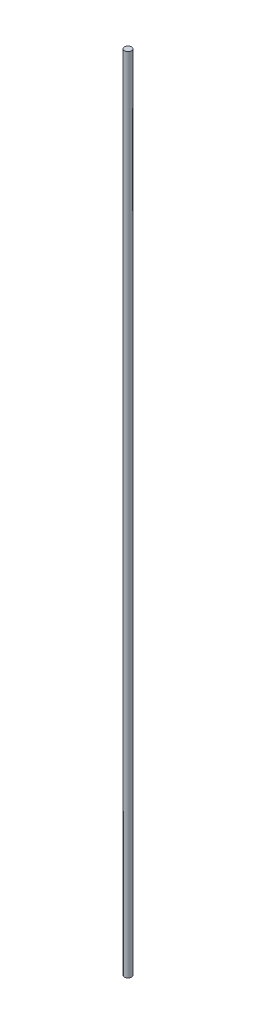
from build123d import *

# Parameters (mm, degrees)
THREADED_ROD_PROFILE_R  = 3.175
THREADED_ROD_BODY_DEPTH = 730.25


with BuildPart() as part:
    # Threaded Rod Profile → Threaded Rod Body (new body)
    with BuildSketch(Plane(origin=(0, 0, 0), x_dir=(1, 0, 0), z_dir=(0, 1, 0))):
        Circle(THREADED_ROD_PROFILE_R)
    extrude(amount=THREADED_ROD_BODY_DEPTH)


solid = part.part
